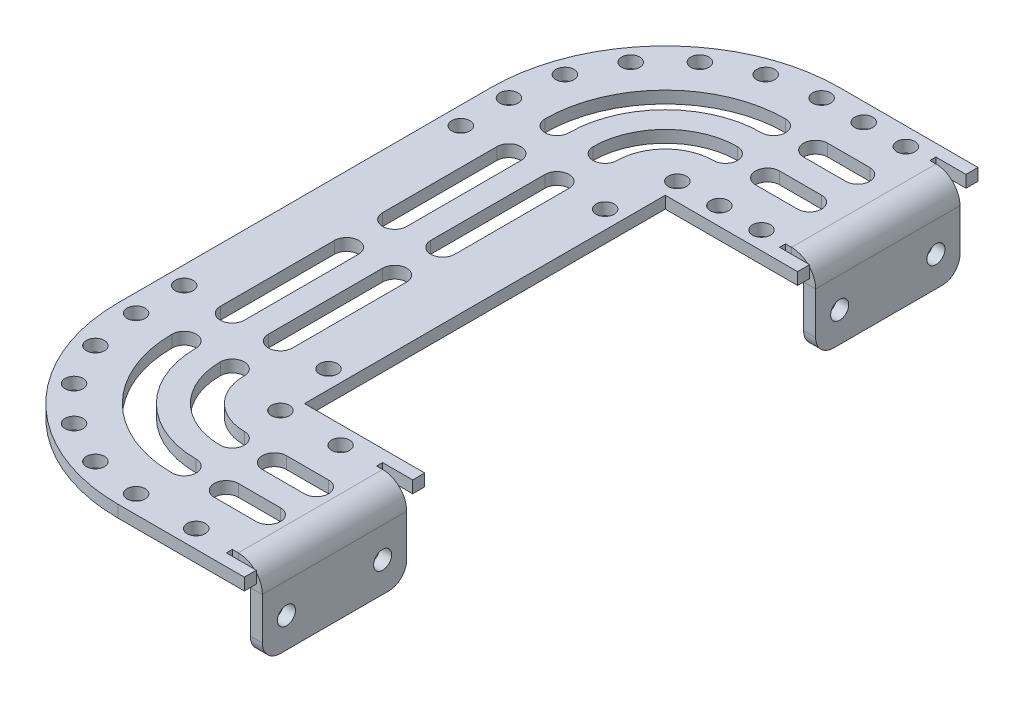
from build123d import *

# Parameters (mm, degrees)
SM_START                          = -2
SM_BASE_FLANGE_1_OUTLINE_R        = 1.5
SM_BASE_FLANGE_1_DEPTH            = 2
SM_EDGE_FLANGE_1_STRIP_W          = 12
SM_EDGE_FLANGE_1_STRIP_H          = 2
SM_EDGE_FLANGE_1_STRIP_CUT_DEPTH  = 24
SM_EDGE_FLANGE_1_RELIEF_W         = 13
SM_EDGE_FLANGE_1_RELIEF_H         = 1
SM_EDGE_FLANGE_1_RELIEF_CUT_DEPTH = 2
SM_EDGE_FLANGE_1_DEPTH            = 24
SM_EDGE_FLANGE_1_PROFILE_W        = 24
SM_EDGE_FLANGE_1_PROFILE_H        = 10
SM_EDGE_FLANGE_1_PROFILE_R        = 1.5
SM_EDGE_FLANGE_1_FLAT_DEPTH       = 2
SM_EDGE_FLANGE_2_STRIP_W          = 12
SM_EDGE_FLANGE_2_STRIP_H          = 2
SM_EDGE_FLANGE_2_STRIP_CUT_DEPTH  = 24
SM_EDGE_FLANGE_2_RELIEF_W         = 13
SM_EDGE_FLANGE_2_RELIEF_H         = 1
SM_EDGE_FLANGE_2_RELIEF_CUT_DEPTH = 2
SM_EDGE_FLANGE_2_DEPTH            = 24
SM_EDGE_FLANGE_2_PROFILE_W        = 24
SM_EDGE_FLANGE_2_PROFILE_H        = 10
SM_EDGE_FLANGE_2_PROFILE_R        = 1.5
SM_EDGE_FLANGE_2_FLAT_DEPTH       = 2
FILLET_1_R                        = 3
CUT_EXTRUDE_1_DEPTH               = 10


# Read off the part's stored shape, not the designer's step: 基体-法兰1
# Sheet-metal steps are written as plain solids
with BuildPart() as part:
    # 基体-法兰1 outline → 基体-法兰1 (new body)
    with BuildSketch(Plane(origin=(0, 0, 0), x_dir=(1, 0, 0), z_dir=(0, 1, 0)).offset(SM_START)):
        with BuildLine():
            ThreePointArc((-50, 23), (-41.506096654, 2.493903346), (-21, -6))
            Line((-21, -6), (0, -6))
            Line((0, -6), (0, 24))
            Line((0, 24), (-20, 24))
            Line((-20, 24), (-20, 84))
            Line((-20, 84), (2, 84))
            Line((2, 84), (2, 114))
            Line((2, 114), (-21, 114))
            ThreePointArc((-21, 114), (-41.506096654, 105.506096654), (-50, 85))
            Line((-50, 85), (-50, 23))
        make_face()
        with Locations((-42.034441854, 7.71758344)):
            Circle(SM_BASE_FLANGE_1_OUTLINE_R, mode=Mode.SUBTRACT)
        with Locations((-45.727469424, 14.965558146)):
            Circle(SM_BASE_FLANGE_1_OUTLINE_R, mode=Mode.SUBTRACT)
        with Locations((-47, 23)):
            Circle(SM_BASE_FLANGE_1_OUTLINE_R, mode=Mode.SUBTRACT)
        with Locations((-36.28241656, 1.965558146)):
            Circle(SM_BASE_FLANGE_1_OUTLINE_R, mode=Mode.SUBTRACT)
        with Locations((-29.034441854, -1.727469424)):
            Circle(SM_BASE_FLANGE_1_OUTLINE_R, mode=Mode.SUBTRACT)
        with Locations((-47, 31)):
            Circle(SM_BASE_FLANGE_1_OUTLINE_R, mode=Mode.SUBTRACT)
        with Locations((-21, -3)):
            Circle(SM_BASE_FLANGE_1_OUTLINE_R, mode=Mode.SUBTRACT)
        with Locations((-21, 21)):
            Circle(SM_BASE_FLANGE_1_OUTLINE_R, mode=Mode.SUBTRACT)
        with Locations((-11, -3)):
            Circle(SM_BASE_FLANGE_1_OUTLINE_R, mode=Mode.SUBTRACT)
        with Locations((-11, 21)):
            Circle(SM_BASE_FLANGE_1_OUTLINE_R, mode=Mode.SUBTRACT)
        with Locations((-23, 31)):
            Circle(SM_BASE_FLANGE_1_OUTLINE_R, mode=Mode.SUBTRACT)
        with Locations((-47, 77)):
            Circle(SM_BASE_FLANGE_1_OUTLINE_R, mode=Mode.SUBTRACT)
        with Locations((-47, 85)):
            Circle(SM_BASE_FLANGE_1_OUTLINE_R, mode=Mode.SUBTRACT)
        with Locations((-45.727469424, 93.034441854)):
            Circle(SM_BASE_FLANGE_1_OUTLINE_R, mode=Mode.SUBTRACT)
        with Locations((-42.034441854, 100.28241656)):
            Circle(SM_BASE_FLANGE_1_OUTLINE_R, mode=Mode.SUBTRACT)
        with Locations((-36.28241656, 106.034441854)):
            Circle(SM_BASE_FLANGE_1_OUTLINE_R, mode=Mode.SUBTRACT)
        with Locations((-29.034441854, 109.727469424)):
            Circle(SM_BASE_FLANGE_1_OUTLINE_R, mode=Mode.SUBTRACT)
        with Locations((-23, 77)):
            Circle(SM_BASE_FLANGE_1_OUTLINE_R, mode=Mode.SUBTRACT)
        with Locations((-21, 87)):
            Circle(SM_BASE_FLANGE_1_OUTLINE_R, mode=Mode.SUBTRACT)
        with Locations((-14, 87)):
            Circle(SM_BASE_FLANGE_1_OUTLINE_R, mode=Mode.SUBTRACT)
        with Locations((-21, 111)):
            Circle(SM_BASE_FLANGE_1_OUTLINE_R, mode=Mode.SUBTRACT)
        with Locations((-14, 111)):
            Circle(SM_BASE_FLANGE_1_OUTLINE_R, mode=Mode.SUBTRACT)
        with Locations((-7, 87)):
            Circle(SM_BASE_FLANGE_1_OUTLINE_R, mode=Mode.SUBTRACT)
        with Locations((-7, 111)):
            Circle(SM_BASE_FLANGE_1_OUTLINE_R, mode=Mode.SUBTRACT)
    extrude(amount=SM_BASE_FLANGE_1_DEPTH)

    # 边线-法兰1 strip (across the edge) → 边线-法兰1 strip cut (cut)
    with BuildSketch(Plane(origin=(2, -2, -111), x_dir=(-1, 0, 0), z_dir=(0, 0, 1))):
        with Locations((-2, -1)):
            Rectangle(SM_EDGE_FLANGE_1_STRIP_W, SM_EDGE_FLANGE_1_STRIP_H)
    extrude(amount=SM_EDGE_FLANGE_1_STRIP_CUT_DEPTH, mode=Mode.SUBTRACT)

    # 边线-法兰1 relief (on the sheet) → 边线-法兰1 relief cut (cut)
    with BuildSketch(Plane(origin=(-2, -2, -111), x_dir=(-1, 0, 0), z_dir=(0, -1, 0))):
        with Locations((-5.5, 0.5)):
            Rectangle(SM_EDGE_FLANGE_1_RELIEF_W, SM_EDGE_FLANGE_1_RELIEF_H)
        with Locations((-5.5, -24.5)):
            Rectangle(SM_EDGE_FLANGE_1_RELIEF_W, SM_EDGE_FLANGE_1_RELIEF_H)
    extrude(amount=-SM_EDGE_FLANGE_1_RELIEF_CUT_DEPTH, mode=Mode.SUBTRACT)

    # 边线-法兰1 bend section (across the edge) → 边线-法兰1 (add)
    with BuildSketch(Plane(origin=(2, -2, -111), x_dir=(-1, 0, 0), z_dir=(0, 0, 1))):
        with BuildLine():
            Line((0, 2), (2, 2))
            ThreePointArc((2, 2), (2.585786438, 0.585786438), (4, 0))
            Line((4, 0), (4, -2))
            ThreePointArc((4, -2), (1.171572875, -0.828427125), (0, 2))
        make_face()
    extrude(amount=SM_EDGE_FLANGE_1_DEPTH)

    # 边线-法兰1 profile (on flange) → 边线-法兰1 flat (add)
    with BuildSketch(Plane(origin=(2, -2, 0), x_dir=(0, 0, 1), z_dir=(1, 0, 0))):
        with Locations((-99, 7)):
            Rectangle(SM_EDGE_FLANGE_1_PROFILE_W, SM_EDGE_FLANGE_1_PROFILE_H)
        with Locations((-91, 7)):
            Circle(SM_EDGE_FLANGE_1_PROFILE_R, mode=Mode.SUBTRACT)
        with Locations((-107, 7)):
            Circle(SM_EDGE_FLANGE_1_PROFILE_R, mode=Mode.SUBTRACT)
    extrude(amount=-SM_EDGE_FLANGE_1_FLAT_DEPTH)

    # 边线-法兰2 strip (across the edge) → 边线-法兰2 strip cut (cut)
    with BuildSketch(Plane(origin=(0, -2, -21), x_dir=(-1, 0, 0), z_dir=(0, 0, 1))):
        with Locations((-2, -1)):
            Rectangle(SM_EDGE_FLANGE_2_STRIP_W, SM_EDGE_FLANGE_2_STRIP_H)
    extrude(amount=SM_EDGE_FLANGE_2_STRIP_CUT_DEPTH, mode=Mode.SUBTRACT)

    # 边线-法兰2 relief (on the sheet) → 边线-法兰2 relief cut (cut)
    with BuildSketch(Plane(origin=(-4, -2, -21), x_dir=(-1, 0, 0), z_dir=(0, -1, 0))):
        with Locations((-5.5, 0.5)):
            Rectangle(SM_EDGE_FLANGE_2_RELIEF_W, SM_EDGE_FLANGE_2_RELIEF_H)
        with Locations((-5.5, -24.5)):
            Rectangle(SM_EDGE_FLANGE_2_RELIEF_W, SM_EDGE_FLANGE_2_RELIEF_H)
    extrude(amount=-SM_EDGE_FLANGE_2_RELIEF_CUT_DEPTH, mode=Mode.SUBTRACT)

    # 边线-法兰2 bend section (across the edge) → 边线-法兰2 (add)
    with BuildSketch(Plane(origin=(0, -2, -21), x_dir=(-1, 0, 0), z_dir=(0, 0, 1))):
        with BuildLine():
            Line((0, 2), (2, 2))
            ThreePointArc((2, 2), (2.585786438, 0.585786438), (4, 0))
            Line((4, 0), (4, -2))
            ThreePointArc((4, -2), (1.171572875, -0.828427125), (0, 2))
        make_face()
    extrude(amount=SM_EDGE_FLANGE_2_DEPTH)

    # 边线-法兰2 profile (on flange) → 边线-法兰2 flat (add)
    with BuildSketch(Plane(origin=(0, -2, 0), x_dir=(0, 0, 1), z_dir=(1, 0, 0))):
        with Locations((-9, 7)):
            Rectangle(SM_EDGE_FLANGE_2_PROFILE_W, SM_EDGE_FLANGE_2_PROFILE_H)
        with Locations((-1, 7)):
            Circle(SM_EDGE_FLANGE_2_PROFILE_R, mode=Mode.SUBTRACT)
        with Locations((-17, 7)):
            Circle(SM_EDGE_FLANGE_2_PROFILE_R, mode=Mode.SUBTRACT)
    extrude(amount=-SM_EDGE_FLANGE_2_FLAT_DEPTH)

    # 圆角1
    fillet_1_edges = [part.edges().sort_by_distance(p)[0] for p in [
        (1, -14, -111),
        (1, -14, -87),
        (-1, -14, -21),
        (-1, -14, 3),
    ]]
    fillet(fillet_1_edges, radius=FILLET_1_R)

    # 草图13 → 切除-拉伸1 (cut)
    with BuildSketch(Plane(origin=(0, 0, 0), x_dir=(1, 0, 0), z_dir=(0, 1, 0))):
        with BuildLine():
            Line((-37, 77), (-37, 58))
            ThreePointArc((-37, 58), (-39, 56), (-41, 58))
            Line((-41, 58), (-41, 77))
            ThreePointArc((-41, 77), (-39, 79), (-37, 77))
        make_face()
        with BuildLine():
            Line((-29, 77), (-29, 58))
            ThreePointArc((-29, 58), (-31, 56), (-33, 58))
            Line((-33, 58), (-33, 77))
            ThreePointArc((-33, 77), (-31, 79), (-29, 77))
        make_face()
        with BuildLine():
            Line((-29, 31), (-29, 50))
            ThreePointArc((-29, 50), (-31, 52), (-33, 50))
            Line((-33, 50), (-33, 31))
            ThreePointArc((-33, 31), (-31, 29), (-29, 31))
        make_face()
        with BuildLine():
            Line((-37, 31), (-37, 50))
            ThreePointArc((-37, 50), (-39, 52), (-41, 50))
            Line((-41, 50), (-41, 31))
            ThreePointArc((-41, 31), (-39, 29), (-37, 31))
        make_face()
        with BuildLine():
            Line((-14, 105), (-7, 105))
            ThreePointArc((-7, 105), (-5, 103), (-7, 101))
            Line((-7, 101), (-14, 101))
            ThreePointArc((-14, 101), (-16, 103), (-14, 105))
        make_face()
        with BuildLine():
            Line((-14, 93), (-7, 93))
            ThreePointArc((-7, 93), (-5, 95), (-7, 97))
            Line((-7, 97), (-14, 97))
            ThreePointArc((-14, 97), (-16, 95), (-14, 93))
        make_face()
        with BuildLine():
            Line((-14, 3), (-7, 3))
            ThreePointArc((-7, 3), (-5, 5), (-7, 7))
            Line((-7, 7), (-14, 7))
            ThreePointArc((-14, 7), (-16, 5), (-14, 3))
        make_face()
        with BuildLine():
            Line((-14, 15), (-7, 15))
            ThreePointArc((-7, 15), (-5, 13), (-7, 11))
            Line((-7, 11), (-14, 11))
            ThreePointArc((-14, 11), (-16, 13), (-14, 15))
        make_face()
        with BuildLine():
            ThreePointArc((-21, 105), (-35.142135624, 99.142135624), (-41, 85))
            ThreePointArc((-41, 85), (-39, 83), (-37, 85))
            ThreePointArc((-37, 85), (-32.313708499, 96.313708499), (-21, 101))
            ThreePointArc((-21, 101), (-19, 103), (-21, 105))
        make_face()
        with BuildLine():
            ThreePointArc((-21, 97), (-29.485281374, 93.485281374), (-33, 85))
            ThreePointArc((-33, 85), (-31, 83), (-29, 85))
            ThreePointArc((-29, 85), (-26.656854249, 90.656854249), (-21, 93))
            ThreePointArc((-21, 93), (-19, 95), (-21, 97))
        make_face()
        with BuildLine():
            ThreePointArc((-21, 3), (-35.142135624, 8.857864376), (-41, 23))
            ThreePointArc((-41, 23), (-39, 25), (-37, 23))
            ThreePointArc((-37, 23), (-32.313708499, 11.686291501), (-21, 7))
            ThreePointArc((-21, 7), (-19, 5), (-21, 3))
        make_face()
        with BuildLine():
            ThreePointArc((-21, 11), (-29.485281374, 14.514718626), (-33, 23))
            ThreePointArc((-33, 23), (-31, 25), (-29, 23))
            ThreePointArc((-29, 23), (-26.656854249, 17.343145751), (-21, 15))
            ThreePointArc((-21, 15), (-19, 13), (-21, 11))
        make_face()
    extrude(amount=-CUT_EXTRUDE_1_DEPTH, mode=Mode.SUBTRACT)


solid = part.part
